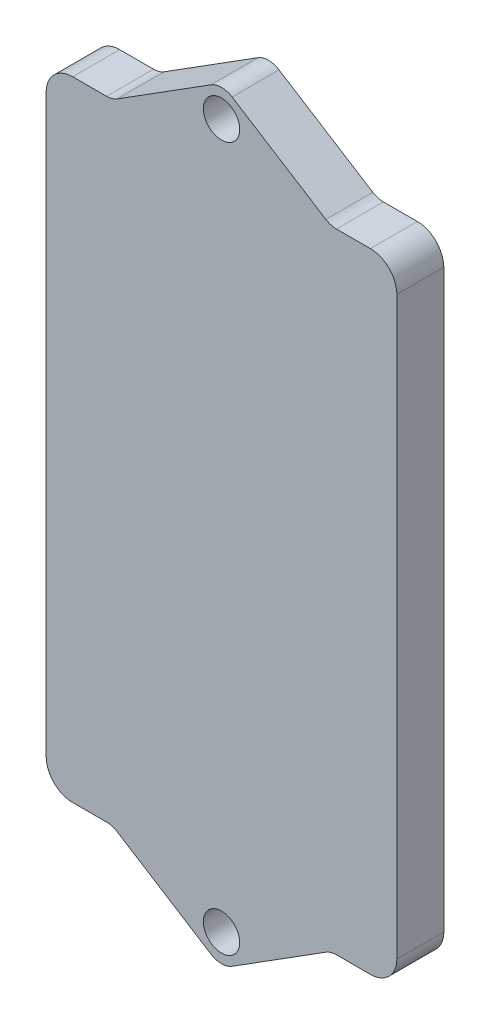
from build123d import *

# Parameters (mm, degrees)
ESQUISSE1_R        = 2.75
BOSS_EXTRU_1_DEPTH = 7.1
CONG_1_R           = 3
CONG_2_R           = 4


with BuildPart() as part:
    # Esquisse1 → Boss.-Extru.1 (new body)
    with BuildSketch(Plane.XY):
        Polygon((10, 95), (26.5, 105.4), (43, 95), (53, 95), (53, 0), (43, 0), (26.5, -10.4), (10, 0), (0, 0), (0, 95), align=None)
        with Locations((26.5, 100.71)):
            Circle(ESQUISSE1_R, mode=Mode.SUBTRACT)
        with Locations((26.5, -5.71)):
            Circle(ESQUISSE1_R, mode=Mode.SUBTRACT)
    extrude(amount=BOSS_EXTRU_1_DEPTH)

    # Congé1
    cong_1_edges = [part.edges().sort_by_distance(p)[0] for p in [
        (43, 0, 3.55),
        (10, 0, 3.55),
        (10, 95, 3.55),
        (43, 95, 3.55),
        (26.5, -10.4, 3.55),
        (26.5, 105.4, 3.55),
    ]]
    fillet(cong_1_edges, radius=CONG_1_R)

    # Congé2
    cong_2_edges = [part.edges().sort_by_distance(p)[0] for p in [
        (0, 95, 3.55),
        (53, 95, 3.55),
        (53, 0, 3.55),
        (0, 0, 3.55),
    ]]
    fillet(cong_2_edges, radius=CONG_2_R)


solid = part.part
